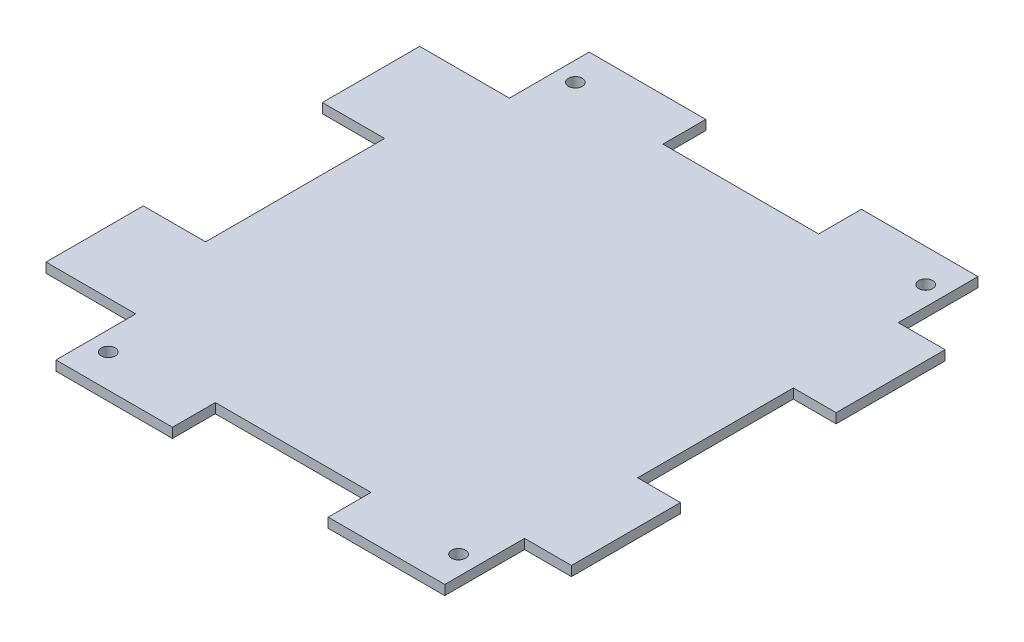
from build123d import *

# Parameters (mm, degrees)
SKETCH1_R           = 2.286
BOSS_EXTRUDE1_DEPTH = 3.175


with BuildPart() as part:
    # Sketch1 → Boss-Extrude1 (new body)
    with BuildSketch(Plane(origin=(0, 0, 0), x_dir=(1, 0, 0), z_dir=(0, 1, 0))):
        Polygon((-25.4, 86.995), (-63.43396, 86.995), (-63.43396, 60.96), (-92.71254, 60.96), (-92.71254, 29.21), (-72.39254, 29.21), (-72.39254, -29.21), (-92.71254, -29.21), (-92.71254, -60.96), (-63.43396, -60.96), (-63.43396, -86.995), (-25.4, -86.995), (-25.4, -73.025), (25.4, -73.025), (25.4, -86.995), (63.43142, -86.995), (63.43142, -60.96), (78.74, -60.96), (78.74, -25.4), (64.77, -25.4), (64.77, 25.4), (78.74, 25.4), (78.74, 60.96), (63.43142, 60.96), (63.43142, 86.995), (25.4, 86.995), (25.4, 73.025), (-25.4, 73.025), align=None)
        with Locations((-57.15, 76.2)):
            Circle(SKETCH1_R, mode=Mode.SUBTRACT)
        with Locations((57.15, 76.2)):
            Circle(SKETCH1_R, mode=Mode.SUBTRACT)
        with Locations((57.15, -76.2)):
            Circle(SKETCH1_R, mode=Mode.SUBTRACT)
        with Locations((-57.15, -76.2)):
            Circle(SKETCH1_R, mode=Mode.SUBTRACT)
    extrude(amount=BOSS_EXTRUDE1_DEPTH)


solid = part.part
